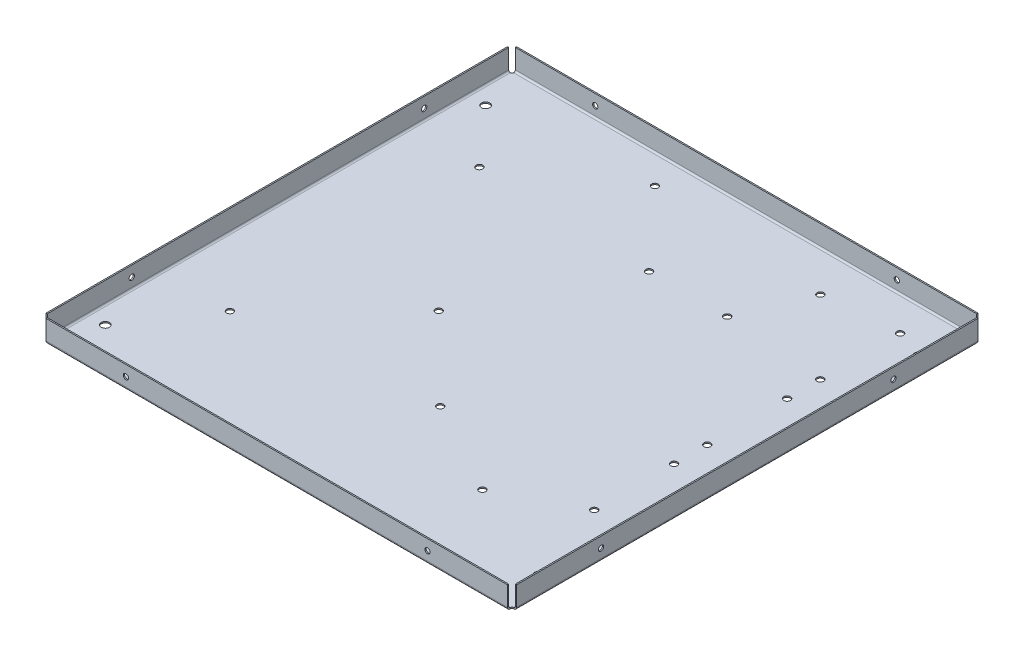
from build123d import *

# Parameters (mm, degrees)
SKETCH1_W                 = 279.4
SKETCH1_H                 = 279.4
BASE_FLANGE1_DEPTH        = 0.75946
SKETCH4_R                 = 1
CUT_EXTRUDE1_DEPTH        = 396.131999184
EDGE_FLANGE1_DEPTH        = 277.4
EDGE_FLANGE1_BEND_DEPTH   = 277.4
EDGE_FLANGE1_BEND_2_DEPTH = 277.4
EDGE_FLANGE1_BEND_3_DEPTH = 277.4
CUT_EXTRUDE2_REACH        = 399.822
SKETCH17_R                = 2.5
SKETCH19_R                = 2
CUT_EXTRUDE3_DEPTH        = 398.822289339
SKETCH20_R                = 2
CUT_EXTRUDE4_DEPTH        = 398.822289339
SKETCH22_R                = 1.5875
CUT_EXTRUDE5_DEPTH        = 400.092613694
SKETCH23_R                = 1.5875
CUT_EXTRUDE6_DEPTH        = 400.092613694


# Sheet-metal steps are written as plain solids
with BuildPart() as part:
    # Sketch1 → Base-Flange1 (new body)
    with BuildSketch(Plane(origin=(0, 0, 0), x_dir=(1, 0, 0), z_dir=(0, 1, 0))):
        with Locations((139.7, 139.7)):
            Rectangle(SKETCH1_W, SKETCH1_H)
    extrude(amount=BASE_FLANGE1_DEPTH)

    # Sketch4 → Cut-Extrude1 (cut, through all)
    with BuildSketch(Plane(origin=(0, 0.75946, 0), x_dir=(1, 0, 0), z_dir=(0, 1, 0))):
        Circle(SKETCH4_R)
        with Locations((0, 279.4)):
            Circle(SKETCH4_R)
        with Locations((279.4, 279.4)):
            Circle(SKETCH4_R)
        with Locations((279.4, 0)):
            Circle(SKETCH4_R)
    extrude(amount=-CUT_EXTRUDE1_DEPTH, mode=Mode.SUBTRACT)

    # Edge-Flange1 section (across the edge) → Edge-Flange1 (add)
    with BuildSketch(Plane(origin=(278.4, 0.75946, -280.4), x_dir=(0, 0, 1), z_dir=(-1, 0, 0))):
        with BuildLine():
            Line((-0.75946, 1), (-0.75946, 12.7))
            Line((-0.75946, 12.7), (0, 12.7))
            Line((0, 12.7), (0, 1))
            ThreePointArc((0, 1), (0.292893219, 0.292893219), (1, 0))
            Line((1, 0), (1, -0.75946))
            ThreePointArc((1, -0.75946), (-0.244126097, -0.244126097), (-0.75946, 1))
        make_face()
    extrude(amount=EDGE_FLANGE1_DEPTH)

    # Edge-Flange1 section 2 (across the edge) → Edge-Flange1 bend (add)
    with BuildSketch(Plane(origin=(-1, 0.75946, -278.4), x_dir=(1, 0, 0), z_dir=(0, 0, 1))):
        with BuildLine():
            Line((-0.75946, 1), (-0.75946, 12.7))
            Line((-0.75946, 12.7), (0, 12.7))
            Line((0, 12.7), (0, 1))
            ThreePointArc((0, 1), (0.292893219, 0.292893219), (1, 0))
            Line((1, 0), (1, -0.75946))
            ThreePointArc((1, -0.75946), (-0.244126097, -0.244126097), (-0.75946, 1))
        make_face()
    extrude(amount=EDGE_FLANGE1_BEND_DEPTH)

    # Edge-Flange1 section 3 (across the edge) → Edge-Flange1 bend 2 (add)
    with BuildSketch(Plane(origin=(1, 0.75946, 1), x_dir=(0, 0, -1), z_dir=(1, 0, 0))):
        with BuildLine():
            Line((-0.75946, 1), (-0.75946, 12.7))
            Line((-0.75946, 12.7), (0, 12.7))
            Line((0, 12.7), (0, 1))
            ThreePointArc((0, 1), (0.292893219, 0.292893219), (1, 0))
            Line((1, 0), (1, -0.75946))
            ThreePointArc((1, -0.75946), (-0.244126097, -0.244126097), (-0.75946, 1))
        make_face()
    extrude(amount=EDGE_FLANGE1_BEND_2_DEPTH)

    # Edge-Flange1 section 4 (across the edge) → Edge-Flange1 bend 3 (add)
    with BuildSketch(Plane(origin=(280.4, 0.75946, -1), x_dir=(-1, 0, 0), z_dir=(0, 0, -1))):
        with BuildLine():
            Line((-0.75946, 1), (-0.75946, 12.7))
            Line((-0.75946, 12.7), (0, 12.7))
            Line((0, 12.7), (0, 1))
            ThreePointArc((0, 1), (0.292893219, 0.292893219), (1, 0))
            Line((1, 0), (1, -0.75946))
            ThreePointArc((1, -0.75946), (-0.244126097, -0.244126097), (-0.75946, 1))
        make_face()
    extrude(amount=EDGE_FLANGE1_BEND_3_DEPTH)

    # Sketch17 → Cut-Extrude2 (cut, up to next)
    with BuildSketch(Plane(origin=(0, 0.75946, 0), x_dir=(1, 0, 0), z_dir=(0, 1, 0)), mode=Mode.PRIVATE) as cut_extrude2_sk1:
        with Locations(Location((9.525, 254, 0), (0, 0, 270))):
            Circle(SKETCH17_R)
    cut_extrude2_tool1 = extrude(cut_extrude2_sk1.sketch, amount=-CUT_EXTRUDE2_REACH, mode=Mode.PRIVATE) & part.part
    # Sketch17 → Cut-Extrude2 (cut, up to next)
    with BuildSketch(Plane(origin=(0, 0.75946, 0), x_dir=(1, 0, 0), z_dir=(0, 1, 0)), mode=Mode.PRIVATE) as cut_extrude2_sk2:
        with Locations(Location((269.875, 254, 0), (0, 0, 270))):
            Circle(SKETCH17_R)
    cut_extrude2_tool2 = extrude(cut_extrude2_sk2.sketch, amount=-CUT_EXTRUDE2_REACH, mode=Mode.PRIVATE) & part.part
    # Sketch17 → Cut-Extrude2 (cut, up to next)
    with BuildSketch(Plane(origin=(0, 0.75946, 0), x_dir=(1, 0, 0), z_dir=(0, 1, 0)), mode=Mode.PRIVATE) as cut_extrude2_sk3:
        with Locations(Location((269.875, 25.4, 0), (0, 0, 270))):
            Circle(SKETCH17_R)
    cut_extrude2_tool3 = extrude(cut_extrude2_sk3.sketch, amount=-CUT_EXTRUDE2_REACH, mode=Mode.PRIVATE) & part.part
    # Sketch17 → Cut-Extrude2 (cut, up to next)
    with BuildSketch(Plane(origin=(0, 0.75946, 0), x_dir=(1, 0, 0), z_dir=(0, 1, 0)), mode=Mode.PRIVATE) as cut_extrude2_sk4:
        with Locations(Location((9.525, 25.4, 0), (0, 0, 270))):
            Circle(SKETCH17_R)
    cut_extrude2_tool4 = extrude(cut_extrude2_sk4.sketch, amount=-CUT_EXTRUDE2_REACH, mode=Mode.PRIVATE) & part.part
    add(cut_extrude2_tool1.solids().sort_by_distance((9.525, 0.75946, -254))[0], mode=Mode.SUBTRACT)
    add(cut_extrude2_tool2.solids().sort_by_distance((269.875, 0.75946, -254))[0], mode=Mode.SUBTRACT)
    add(cut_extrude2_tool3.solids().sort_by_distance((269.875, 0.75946, -25.4))[0], mode=Mode.SUBTRACT)
    add(cut_extrude2_tool4.solids().sort_by_distance((9.525, 0.75946, -25.4))[0], mode=Mode.SUBTRACT)

    # Sketch19 → Cut-Extrude3 (cut, through all)
    with BuildSketch(Plane(origin=(0, 0.75946, 0), x_dir=(1, 0, 0), z_dir=(0, 1, 0))):
        with Locations(Location((252.84054, 259.9, 0), (0, 0, 270))):
            Circle(SKETCH19_R)
        with Locations(Location((252.84054, 211.9, 0), (0, 0, 270))):
            Circle(SKETCH19_R)
        with Locations(Location((252.84054, 191.95, 0), (0, 0, 270))):
            Circle(SKETCH19_R)
        with Locations(Location((252.84054, 143.95, 0), (0, 0, 270))):
            Circle(SKETCH19_R)
        with Locations(Location((252.84054, 124, 0), (0, 0, 270))):
            Circle(SKETCH19_R)
        with Locations(Location((252.84054, 76, 0), (0, 0, 270))):
            Circle(SKETCH19_R)
    extrude(amount=-CUT_EXTRUDE3_DEPTH, mode=Mode.SUBTRACT)

    # Sketch20 → Cut-Extrude4 (cut, through all)
    with BuildSketch(Plane(origin=(0, 0.75946, 0), x_dir=(1, 0, 0), z_dir=(0, 1, 0))):
        with Locations(Location((102.4, 262.94, 0), (0, 0, 270))):
            Circle(SKETCH20_R)
        with Locations(Location((102.4, 132.94, 0), (0, 0, 270))):
            Circle(SKETCH20_R)
        with Locations(Location((39.81, 220, 0), (0, 0, 270))):
            Circle(SKETCH20_R)
        with Locations(Location((39.81, 70, 0), (0, 0, 270))):
            Circle(SKETCH20_R)
        with Locations(Location((152.58, 83.7, 0), (0, 0, 270))):
            Circle(SKETCH20_R)
        with Locations(Location((192.1, 216.7, 0), (0, 0, 270))):
            Circle(SKETCH20_R)
        with Locations(Location((145.1, 216.7, 0), (0, 0, 270))):
            Circle(SKETCH20_R)
        with Locations(Location((208.68, 256.14, 0), (0, 0, 270))):
            Circle(SKETCH20_R)
        with Locations(Location((208.68, 52.94, 0), (0, 0, 270))):
            Circle(SKETCH20_R)
    extrude(amount=-CUT_EXTRUDE4_DEPTH, mode=Mode.SUBTRACT)

    # Sketch22 → Cut-Extrude5 (cut, through all)
    with BuildSketch(Plane.XY.offset(1.75946)):
        with Locations((49.04054, 7.10946)):
            Circle(SKETCH22_R)
        with Locations((230.35946, 7.10946)):
            Circle(SKETCH22_R)
    extrude(amount=-CUT_EXTRUDE5_DEPTH, mode=Mode.SUBTRACT)

    # Sketch23 → Cut-Extrude6 (cut, through all)
    with BuildSketch(Plane.ZY.offset(1.75946)):
        with Locations(Location((-227.6, 7.10946, 0), (0, 0, 270))):
            Circle(SKETCH23_R)
        with Locations(Location((-51.8, 7.10946, 0), (0, 0, 270))):
            Circle(SKETCH23_R)
    extrude(amount=-CUT_EXTRUDE6_DEPTH, mode=Mode.SUBTRACT)


solid = part.part
